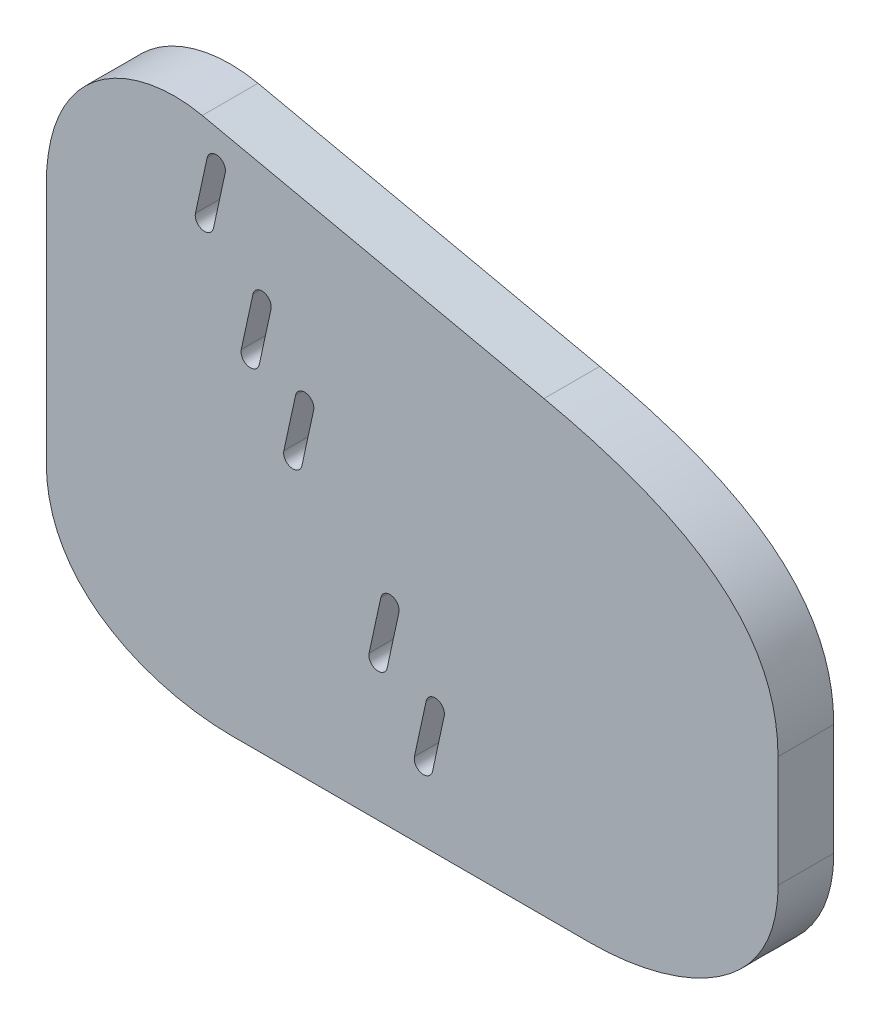
from build123d import *

# Parameters (mm, degrees)
EXTRUDE_1_DEPTH     = 10
CUT_EXTRUDE_1_DEPTH = 149.427210809
OTHER_1_DEPTH       = 10


# Read off the part's stored shape, not the designer's step: Массив, управляемый таблицей1
with BuildPart() as part:
    # Эскиз1_fr → Бобышка-Вытянуть1 (new body)
    with BuildSketch(Plane.XY):
        with BuildLine():
            Line((0, 0), (0, 20))
            add(Edge.make_bspline(
                [(0, 20), (0, 38.146025899), (-14.209474182, 48.611098897), (-41.986949672, 54.649680525)],
                knots=[0, 0, 0, 0, 1, 1, 1, 1], degree=3))
            Line((-41.986949672, 54.649680525), (-103.301225383, 67.978870897))
            add(Edge.make_bspline(
                [(-103.301225383, 67.978870897), (-115.500001367, 70.63077872), (-131.292525164, 63.393306184), (-131.292525164, 43.097715536)],
                knots=[0, 0, 0, 0, 1, 1, 1, 1], degree=3))
            Line((-131.292525164, 43.097715536), (-131.292525164, 0))
            add(Edge.make_bspline(
                [(-97.969549234, -25.769768053), (-112.011160689, -25.769768053), (-131.292525164, -19.025155818), (-131.292525164, 0)],
                knots=[0, 0, 0, 0, 1, 1, 1, 1], degree=3))
            Line((-97.969549234, -25.769768053), (-33.545129103, -25.769768053))
            add(Edge.make_bspline(
                [(-33.545129103, -25.769768053), (-19.444866568, -25.769768053), (0, -19.063757455), (0, 0)],
                knots=[0, 0, 0, 0, 1, 1, 1, 1], degree=3))
        make_face()
    extrude(amount=EXTRUDE_1_DEPTH)

    # Эскиз2_fr → Вырез-Вытянуть1 (cut, through all)
    with BuildSketch(Plane(origin=(0, 0, 0), x_dir=(-1, 0, 0), z_dir=(0, 0, -1))):
        with BuildLine():
            Line((102.429251955, 61.832882372), (104.527789693, 52.179608775))
            ThreePointArc((104.527789693, 52.179608775), (103.259303337, 50.206407776), (101.286102339, 51.474894133))
            Line((101.286102339, 51.474894133), (99.1875646, 61.128167729))
            ThreePointArc((99.1875646, 61.128167729), (100.456050956, 63.101368728), (102.429251955, 61.832882372))
        make_face()
    extrude(amount=-CUT_EXTRUDE_1_DEPTH, mode=Mode.SUBTRACT)

    # Массив, управляемый таблицей1 outline → Массив, управляемый таблицей1 (cut)
    with BuildSketch(Plane.XY):
        with BuildLine():
            ThreePointArc((-59.89006563, -3.637341625), (-61.158551986, -1.664140626), (-63.131752985, -2.932626983))
            Line((-63.131752985, -2.932626983), (-65.230290724, -12.585900579))
            ThreePointArc((-65.230290724, -12.585900579), (-63.961804368, -14.559101578), (-61.988603369, -13.290615222))
            Line((-61.988603369, -13.290615222), (-59.89006563, -3.637341625))
        make_face()
        with BuildLine():
            ThreePointArc((-68.026121008, 8.36493328), (-69.294607365, 10.338134278), (-71.267808363, 9.069647922))
            Line((-71.267808363, 9.069647922), (-73.366346102, -0.583625675))
            ThreePointArc((-73.366346102, -0.583625675), (-72.097859745, -2.556826673), (-70.124658747, -1.288340317))
            Line((-70.124658747, -1.288340317), (-68.026121008, 8.36493328))
        make_face()
        with BuildLine():
            ThreePointArc((-83.3210554, 32.157053445), (-84.589541757, 34.130254443), (-86.562742755, 32.861768087))
            Line((-86.562742755, 32.861768087), (-88.661280493, 23.208494491))
            ThreePointArc((-88.661280493, 23.208494491), (-87.392794137, 21.235293492), (-85.419593138, 22.503779848))
            Line((-85.419593138, 22.503779848), (-83.3210554, 32.157053445))
        make_face()
        with BuildLine():
            ThreePointArc((-90.968522596, 44.053113527), (-92.237008952, 46.026314526), (-94.210209951, 44.75782817))
            Line((-94.210209951, 44.75782817), (-96.308747689, 35.104554573))
            ThreePointArc((-96.308747689, 35.104554573), (-95.040261333, 33.131353574), (-93.067060334, 34.399839931))
            Line((-93.067060334, 34.399839931), (-90.968522596, 44.053113527))
        make_face()
    extrude(amount=OTHER_1_DEPTH, mode=Mode.SUBTRACT)


solid = part.part
